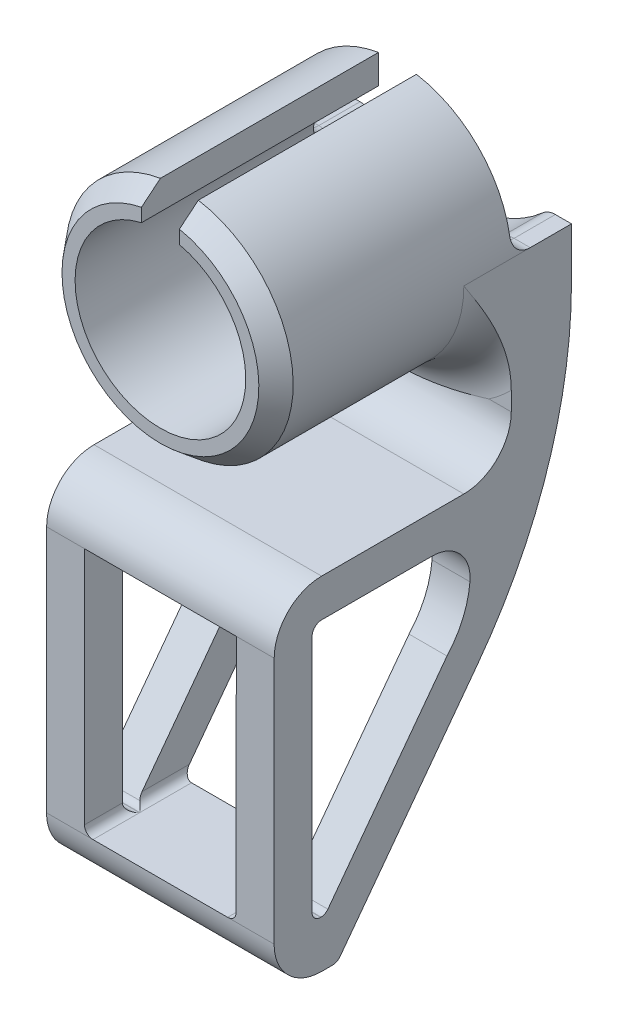
from build123d import *

# Parameters (mm, degrees)
SKETCH1_R           = 12
BOSS_EXTRUDE1_DEPTH = 25
CUT_EXTRUDE1_DEPTH  = 25
BOSS_EXTRUDE2_DEPTH = 6.35
FILLET1_R           = 7.62
CHAMFER1_SIZE       = 2
CHAMFER1_SIZE2      = 1.6195680663900194
BOSS_EXTRUDE3_DEPTH = 3
BOSS_EXTRUDE4_DEPTH = 24
FILLET3_R           = 50
FILLET7_R           = 5
FILLET8_R           = 5
FILLET9_R           = 5
CUT_EXTRUDE2_DEPTH  = 24
FILLET10_R          = 1
FILLET12_R          = 2
FILLET13_R          = 2
CUT_EXTRUDE3_REACH  = 66.534
SKETCH9_W           = 16.00000000000001
SKETCH9_H           = 26.111776117406702
FILLET15_R          = 4
BOSS_EXTRUDE5_REACH = 69.872
FILLET16_R          = 0.9


with BuildPart() as part:
    # Sketch1 → Boss-Extrude1 (new body)
    with BuildSketch(Plane.XY):
        Circle(SKETCH1_R)
    extrude(amount=BOSS_EXTRUDE1_DEPTH)

    # Sketch2 → Cut-Extrude1 (cut)
    with BuildSketch(Plane.XY.offset(25)):
        with BuildLine():
            Line((-2, 12), (2, 12))
            Line((2, 12), (2, 8.77496438739212))
            ThreePointArc((2, 8.77496438739212), (-1.65e-15, -8.999999999999998), (-2, 8.77496438739212))
            Line((-2, 8.77496438739212), (-2, 12))
        make_face()
    extrude(amount=-CUT_EXTRUDE1_DEPTH, mode=Mode.SUBTRACT)

    # Sketch3 → Boss-Extrude2 (add)
    with BuildSketch(Plane(origin=(0, 0, 0), x_dir=(-1, 0, 0), z_dir=(0, 0, -1))):
        with BuildLine():
            Line((-9.50278743316929, 0), (-12.000000000000002, 0))
            Line((-12.000000000000002, 0), (-12.000000000000004, -19))
            Line((-12.000000000000004, -19), (12.000000000000004, -19))
            Line((12.000000000000004, -19), (12.000000000000002, 0))
            Line((12.000000000000002, 0), (9.50278743316929, 0))
            ThreePointArc((9.50278743316929, 0), (8.2e-16, -3.9369999999999994), (-9.50278743316929, 0))
        make_face()
    extrude(amount=BOSS_EXTRUDE2_DEPTH)

    # Fillet1
    # the kernel refuses this fillet: 7.62 mm, written as the material it adds along each edge
    with BuildSketch(Plane(origin=(-8.3e-16, 4.2e-16, 0), x_dir=(0.0031415874858799547, 0.9999950652018581, 0), z_dir=(-0.9999950652018581, 0.0031415874858799547, 0))) as fillet1_piece_1_section:
        with BuildLine():
            CenterArc((8.999999999999998 - FILLET1_R, -FILLET1_R), FILLET1_R, 0, 89.99999999999999)
            Line((8.999999999999998 - FILLET1_R, 2.66e-15), (8.999999999999998, 0))
            Line((8.999999999999998, 0), (8.999999999999996, -FILLET1_R))
        make_face()
    fillet1_piece_1 = revolve(axis=Axis((-8.3e-16, 4.2e-16, 0), (0, 0, -1)), revolution_arc=359.64, mode=Mode.PRIVATE)
    fillet1_piece_1 = fillet1_piece_1 - Plane(origin=(0, 9.500000000000028, 1.752978238820399), x_dir=(-0.7072104958822112, -0.7070030512763273, 0), z_dir=(0, 0, 1)) * Cylinder(13.437000000000028, 36, mode=Mode.PRIVATE)
    add(fillet1_piece_1)

    # Chamfer1
    chamfer1_edges = [part.edges().sort_by_distance(p)[0] for p in [
        (-1.0525e-13, -12, 25),
    ]]
    chamfer1_side = [part.faces().sort_by_distance(p)[0] for p in [
        (-2.2e-15, -12, 12.5),
    ]]
    chamfer(chamfer1_edges, length=CHAMFER1_SIZE, length2=CHAMFER1_SIZE2, reference=chamfer1_side[0])

    # Sketch6 → Boss-Extrude3 (add)
    with BuildSketch(Plane.XZ.offset(19)):
        Polygon((-12.000000000000007, 25), (-12.000000000000005, -6.35), (12.000000000000005, -6.35), (12.000000000000004, 25.00000000000001), align=None)
    extrude(amount=BOSS_EXTRUDE3_DEPTH)

    # Sketch7 → Boss-Extrude4 (add)
    with BuildSketch(Plane(origin=(12.000000000000002, 1.1e-15, 0), x_dir=(0, 0, -1), z_dir=(1, 1.9e-16, 0))):
        Polygon((-25.00000000000001, -22.000000000000004), (6.35, -22.000000000000004), (-18.348646063087493, -55.11177405445072), (-25.013162071560505, -55.11177405445072), align=None)
    extrude(amount=-BOSS_EXTRUDE4_DEPTH)

    # Fillet3
    fillet3_edges = [part.edges().sort_by_distance(p)[0] for p in [
        (0, -22, -6.35),
    ]]
    fillet(fillet3_edges, radius=FILLET3_R)

    # Fillet7
    # the kernel refuses this fillet: 5 mm, written as the material it adds along each edge
    with BuildSketch(Plane(origin=(0, 0, 0), x_dir=(-1, 6e-17, 0), z_dir=(6e-17, 1, 0))) as fillet7_piece_1_section:
        with BuildLine():
            CenterArc((12.000000000000002 + FILLET7_R, FILLET7_R), FILLET7_R, 180, 90)
            Line((12, FILLET7_R), (12.000000000000002, 0))
            Line((12.000000000000002, 0), (12.000000000000002 + FILLET7_R, 0))
        make_face()
    fillet7_piece_1 = revolve(axis=Axis((0, 0, 0), (0, 0, 1)), revolution_arc=179.99999999999997, mode=Mode.PRIVATE)
    fillet7_piece_1 = split(fillet7_piece_1, bisect_by=Plane(origin=(12.000000000000004, -12.055106327045037, 2.4999999999999996), z_dir=(-1, -9e-17, 0)), keep=Keep.TOP, mode=Mode.PRIVATE)
    fillet7_piece_1 = split(fillet7_piece_1, bisect_by=Plane(origin=(-12.000000000000004, -12.055106327045038, 2.4999999999999996), z_dir=(1, -9e-17, 0)), keep=Keep.TOP, mode=Mode.PRIVATE)
    add(fillet7_piece_1)
    with BuildSketch(Plane(origin=(12.000000000000004, -19, 0), x_dir=(0, 1, 0), z_dir=(-1, 0, 0))) as fillet7_piece_2:
        with BuildLine():
            CenterArc((FILLET7_R, -FILLET7_R), FILLET7_R, 90, 90)
            Line((0, -FILLET7_R), (0, 0))
            Line((0, 0), (FILLET7_R, 0))
        make_face()
    extrude(amount=24.000000000000007)

    # Fillet8
    fillet8_edges = [part.edges().sort_by_distance(p)[0] for p in [
        (1.243e-14, -55.11177405445072, 25.013162071560505),
    ]]
    fillet(fillet8_edges, radius=FILLET8_R)

    # Fillet9
    fillet9_edges = [part.edges().sort_by_distance(p)[0] for p in [
        (-1.78e-15, -19, 25.000000000000007),
    ]]
    fillet(fillet9_edges, radius=FILLET9_R)

    # Sketch8 → Cut-Extrude2 (cut)
    with BuildSketch(Plane(origin=(12.000000000000002, 1.1e-15, 0), x_dir=(0, 0, -1), z_dir=(1, 1.9e-16, 0))):
        with BuildLine():
            Line((-4.999999999999998, -23), (-20.000794613515104, -23.000000000000004))
            ThreePointArc((-20.000794613515104, -23.000000000000004), (-20.70776084176148, -23.292752693805703), (-21.000794534510295, -23.999602495761817))
            Line((-21.000794534510295, -23.999602495761817), (-21.011174076183625, -50.11137655021254))
            ThreePointArc((-21.011174076183625, -50.11137655021254), (-20.819933843558175, -50.699913295165096), (-20.318980441541633, -51.06322310199948))
            Line((-20.318980441541633, -51.06322310199948), (-6.777868461008763, -32.90958669617576))
            ThreePointArc((-6.777868461008763, -32.90958669617576), (-4.469648137926145, -28.20942596380706), (-4.999999999999998, -23))
        make_face()
    extrude(amount=-CUT_EXTRUDE2_DEPTH, mode=Mode.SUBTRACT)

    # Fillet10
    fillet10_edges = [part.edges().sort_by_distance(p)[0] for p in [
        (1.243e-14, -55.11177405445072, 18.348646063087493),
    ]]
    fillet(fillet10_edges, radius=FILLET10_R)

    # Fillet12
    fillet12_edges = [part.edges().sort_by_distance(p)[0] for p in [
        (-9.502787433169292, -8.9e-16, -3.175),
        (9.502787433169292, -8.9e-16, -3.175),
    ]]
    fillet(fillet12_edges, radius=FILLET12_R)

    # Fillet13
    # the kernel refuses this fillet: 2 mm, written as the material it adds along each edge
    with BuildSketch(Plane(origin=(10.298105116962052, 0, 0), x_dir=(0, 0, -1), z_dir=(1, 0, 0))) as fillet13_piece_1_section:
        with BuildLine():
            CenterArc((FILLET13_R, FILLET13_R), FILLET13_R, 180, 90)
            Line((-2.2e-16, FILLET13_R), (0, 0))
            Line((0, 0), (FILLET13_R, 0))
        make_face()
    fillet13_piece_1 = extrude(amount=6.701894883037948, mode=Mode.PRIVATE)
    fillet13_piece_1 = fillet13_piece_1 & Plane(origin=(0, 0, -0.44903446636731825), x_dir=(1, 0, 0), z_dir=(0, 0, -1)) * Cylinder(12, 22, mode=Mode.PRIVATE)
    add(fillet13_piece_1)
    with BuildSketch(Plane(origin=(-10.298105116962049, -2, 0), x_dir=(-0.07369380939887726, -0.9972809145152042, 0), z_dir=(-0.9972809145152042, 0.07369380939887726, 0))) as fillet13_piece_2_section:
        with BuildLine():
            CenterArc((2.0000000000000004 + FILLET13_R, -FILLET13_R), FILLET13_R, 89.99999999999997, 90)
            Line((2.0000000000000004 + FILLET13_R, 2.2e-16), (2.0000000000000004, 0))
            Line((2.0000000000000004, 0), (2, -FILLET13_R))
        make_face()
    fillet13_piece_2 = revolve(axis=Axis((-10.298105116962049, -2, 0), (0, 0, 1)), revolution_arc=184.22617539365706, mode=Mode.PRIVATE)
    fillet13_piece_2 = fillet13_piece_2 - Plane(origin=(-8.3e-16, 4.2e-16, -0.6407272575669332), x_dir=(0.22222222222222238, 0.9749960430435691, 0), z_dir=(0, 0, 1)) * Cylinder(8.999999999999998, 17, mode=Mode.PRIVATE)
    add(fillet13_piece_2)
    with BuildSketch(Plane(origin=(10.298105116962052, -2, 0), x_dir=(0, 1, 0), z_dir=(1, 0, 0))) as fillet13_piece_3_section:
        with BuildLine():
            CenterArc((2 + FILLET13_R, -FILLET13_R), FILLET13_R, 90, 90)
            Line((2 + FILLET13_R, 2.2e-16), (2, 0))
            Line((2, 0), (2, -FILLET13_R))
        make_face()
    fillet13_piece_3 = revolve(axis=Axis((10.298105116962052, -2, 0), (0, 0, 1)), revolution_arc=184.22617539365754, mode=Mode.PRIVATE)
    fillet13_piece_3 = fillet13_piece_3 - Plane(origin=(-8.3e-16, 4.2e-16, -0.8153326958488982), x_dir=(0.22222222222222238, 0.9749960430435691, 0), z_dir=(0, 0, 1)) * Cylinder(8.999999999999998, 16, mode=Mode.PRIVATE)
    add(fillet13_piece_3)
    with BuildSketch(Plane(origin=(-17, 0, 0), x_dir=(0, 0, -1), z_dir=(1, 0, 0))) as fillet13_piece_4_section:
        with BuildLine():
            CenterArc((FILLET13_R, FILLET13_R), FILLET13_R, 180, 90)
            Line((-2.2e-16, FILLET13_R), (0, 0))
            Line((0, 0), (FILLET13_R, 0))
        make_face()
    fillet13_piece_4 = extrude(amount=6.7018948830379514, mode=Mode.PRIVATE)
    fillet13_piece_4 = fillet13_piece_4 & Plane(origin=(0, 0, -0.4490342356486683), x_dir=(1, 0, 0), z_dir=(0, 0, -1)) * Cylinder(12, 22, mode=Mode.PRIVATE)
    add(fillet13_piece_4)

    # Cut-Extrude3: up to this plane
    cut_extrude3_end = Plane(origin=(-57.60742830022284, -22.000000000000018, -6.35), z_dir=(0, -0.5979035190056836, -0.8015680769345921))
    # Sketch9 → Cut-Extrude3 (cut, up to the surface)
    with BuildSketch(Plane(origin=(0, 0.00993412895799998, 24.991250957210262), x_dir=(1, 0, 0), z_dir=(0, 0.0003975042381898005, 0.9999999209951873)), mode=Mode.PRIVATE) as cut_extrude3_sk1:
        with Locations((0, -37.06383656321388)):
            Rectangle(SKETCH9_W, SKETCH9_H)
    cut_extrude3_tool1 = split(extrude(cut_extrude3_sk1.sketch, amount=-CUT_EXTRUDE3_REACH, mode=Mode.PRIVATE), bisect_by=cut_extrude3_end, keep=Keep.BOTH, mode=Mode.PRIVATE)
    add(cut_extrude3_tool1.solids().sort_by_distance((0, -37.0539, 25.005984))[0], mode=Mode.SUBTRACT)

    # Fillet15
    # the kernel refuses this fillet: 4 mm, written as the material it adds along each edge
    with BuildSketch(Plane(origin=(12.000000000000007, -23, 4.999999999999999), x_dir=(0, 0, 1), z_dir=(-1, -1.9e-16, 0))) as fillet15_piece_1_section:
        with BuildLine():
            CenterArc((3.3402809515369762, -4), FILLET15_R, 89.99999999999997, 94.89048853854479)
            ThreePointArc((-0.6451568973076123, -4.341006089384081), (-0.5764760987946635, -2.1327689764079274), (0, 0))
            Line((0, 0), (3.340280951536978, 0))
        make_face()
    fillet15_piece_1 = extrude(amount=24, mode=Mode.PRIVATE)
    fillet15_piece_1 = split(fillet15_piece_1, bisect_by=Plane(origin=(10.00000000000001, -24.005623928158137, 5.852699641182596), z_dir=(0, 0.9999999209951872, -0.0003975042381898005)), keep=Keep.TOP, mode=Mode.PRIVATE)
    fillet15_piece_1 = split(fillet15_piece_1, bisect_by=Plane(origin=(8.000000000000005, -23.36055913801038, 5.852443225174341), z_dir=(1, 0, 0)), keep=Keep.TOP, mode=Mode.PRIVATE)
    add(fillet15_piece_1)
    with BuildSketch(Plane(origin=(12.000000000000007, -23, 4.999999999999999), x_dir=(0, 0, 1), z_dir=(-1, -1.9e-16, 0))) as fillet15_piece_2_section:
        with BuildLine():
            CenterArc((3.3402809515369762, -4), FILLET15_R, 89.99999999999997, 94.89048853854479)
            ThreePointArc((-0.6451568973076123, -4.341006089384081), (-0.5764760987946635, -2.1327689764079274), (0, 0))
            Line((0, 0), (3.340280951536978, 0))
        make_face()
    fillet15_piece_2 = extrude(amount=24, mode=Mode.PRIVATE)
    fillet15_piece_2 = split(fillet15_piece_2, bisect_by=Plane(origin=(9.999999999999982, -24.006080855539047, 4.703209142937297), z_dir=(0, -0.9999999209951872, 0.0003975042381898005)), keep=Keep.TOP, mode=Mode.PRIVATE)
    fillet15_piece_2 = split(fillet15_piece_2, bisect_by=Plane(origin=(8.000000000000005, -24.979834026786314, 4.7035962139803935), z_dir=(1, 0, 0)), keep=Keep.TOP, mode=Mode.PRIVATE)
    add(fillet15_piece_2)
    with BuildSketch(Plane(origin=(12.000000000000007, -23, 4.999999999999999), x_dir=(0, 0, 1), z_dir=(-1, -1.9e-16, 0))) as fillet15_piece_3_section:
        with BuildLine():
            CenterArc((3.3402809515369762, -4), FILLET15_R, 89.99999999999997, 94.89048853854479)
            ThreePointArc((-0.6451568973076123, -4.341006089384081), (-0.5764760987946635, -2.1327689764079274), (0, 0))
            Line((0, 0), (3.340280951536978, 0))
        make_face()
    fillet15_piece_3 = extrude(amount=24, mode=Mode.PRIVATE)
    fillet15_piece_3 = split(fillet15_piece_3, bisect_by=Plane(origin=(-8.000000000000005, -23.360559138010377, 5.852443225174337), z_dir=(1, 0, 0)), keep=Keep.TOP, mode=Mode.PRIVATE)
    fillet15_piece_3 = split(fillet15_piece_3, bisect_by=Plane(origin=(-1.954e-14, -24.005623928158137, 5.852699641182593), z_dir=(0, 0.9999999209951872, -0.0003975042381898005)), keep=Keep.TOP, mode=Mode.PRIVATE)
    fillet15_piece_3 = split(fillet15_piece_3, bisect_by=Plane(origin=(8.000000000000005, -23.36055913801037, 5.852443225174337), z_dir=(-1, 0, 0)), keep=Keep.TOP, mode=Mode.PRIVATE)
    add(fillet15_piece_3)
    with BuildSketch(Plane(origin=(12.000000000000007, -23, 4.999999999999999), x_dir=(0, 0, 1), z_dir=(-1, -1.9e-16, 0))) as fillet15_piece_4_section:
        with BuildLine():
            CenterArc((3.3402809515369762, -4), FILLET15_R, 89.99999999999997, 94.89048853854479)
            ThreePointArc((-0.6451568973076123, -4.341006089384081), (-0.5764760987946635, -2.1327689764079274), (0, 0))
            Line((0, 0), (3.340280951536978, 0))
        make_face()
    fillet15_piece_4 = extrude(amount=24, mode=Mode.PRIVATE)
    fillet15_piece_4 = split(fillet15_piece_4, bisect_by=Plane(origin=(-8.000000000000005, -23.360559138010377, 5.852443225174341), z_dir=(-1, 0, 0)), keep=Keep.TOP, mode=Mode.PRIVATE)
    fillet15_piece_4 = split(fillet15_piece_4, bisect_by=Plane(origin=(-10.000000000000002, -24.005623928158137, 5.852699641182593), z_dir=(0, 0.9999999209951872, -0.0003975042381898005)), keep=Keep.TOP, mode=Mode.PRIVATE)
    add(fillet15_piece_4)
    with BuildSketch(Plane(origin=(12.000000000000007, -23, 4.999999999999999), x_dir=(0, 0, 1), z_dir=(-1, -1.9e-16, 0))) as fillet15_piece_5_section:
        with BuildLine():
            CenterArc((3.3402809515369762, -4), FILLET15_R, 89.99999999999997, 94.89048853854479)
            ThreePointArc((-0.6451568973076123, -4.341006089384081), (-0.5764760987946635, -2.1327689764079274), (0, 0))
            Line((0, 0), (3.340280951536978, 0))
        make_face()
    fillet15_piece_5 = extrude(amount=24, mode=Mode.PRIVATE)
    fillet15_piece_5 = split(fillet15_piece_5, bisect_by=Plane(origin=(-8.000000000000005, -24.979834026786307, 4.70359621398039), z_dir=(-1, 0, 0)), keep=Keep.TOP, mode=Mode.PRIVATE)
    fillet15_piece_5 = split(fillet15_piece_5, bisect_by=Plane(origin=(-10.000000000000002, -24.006080855539047, 4.703209142937293), z_dir=(0, -0.9999999209951872, 0.0003975042381898005)), keep=Keep.TOP, mode=Mode.PRIVATE)
    add(fillet15_piece_5)

    # Sketch10 → Boss-Extrude5 (add, up to next)
    with BuildSketch(Plane(origin=(0, -50.1197206622178, 0.01992280295411781), x_dir=(1, 0, 0), z_dir=(0, 0.9999999209951873, -0.00039750423818980053)), mode=Mode.PRIVATE) as boss_extrude5_sk1:
        Polygon((-12.00000000000001, -19.589475982962057), (12.00000000000001, -19.589475982962057), (12.000000000000012, -20.99125293163952), (-12.000000000000005, -20.99125293163952), align=None)
    boss_extrude5_tool1 = extrude(boss_extrude5_sk1.sketch, amount=-BOSS_EXTRUDE5_REACH, mode=Mode.PRIVATE) - part.part
    add(boss_extrude5_tool1.solids().sort_by_distance((0, -50.111655, 20.310286))[0])

    # Fillet16
    fillet16_edges = [part.edges().sort_by_distance(p)[0] for p in [
        (-9.999999999999996, -50.11137655021255, 21.01117407618362),
        (10.000000000000007, -50.11137655021254, 21.01117407618362),
        (8.000000000000005, -50.11292528511694, 17.1150274864303),
        (8.000000000000005, -50.11058154173617, 23.011173918174002),
        (-8.000000000000005, -50.11292528511694, 17.115027486430296),
        (-8.000000000000005, -50.11058154173617, 23.011173918174002),
        (10.000000000000007, -50.11193376249066, 19.609397238253294),
        (-10.000000000000007, -50.11193376249066, 19.609397238253294),
    ]]
    fillet(fillet16_edges, radius=FILLET16_R)


solid = part.part
